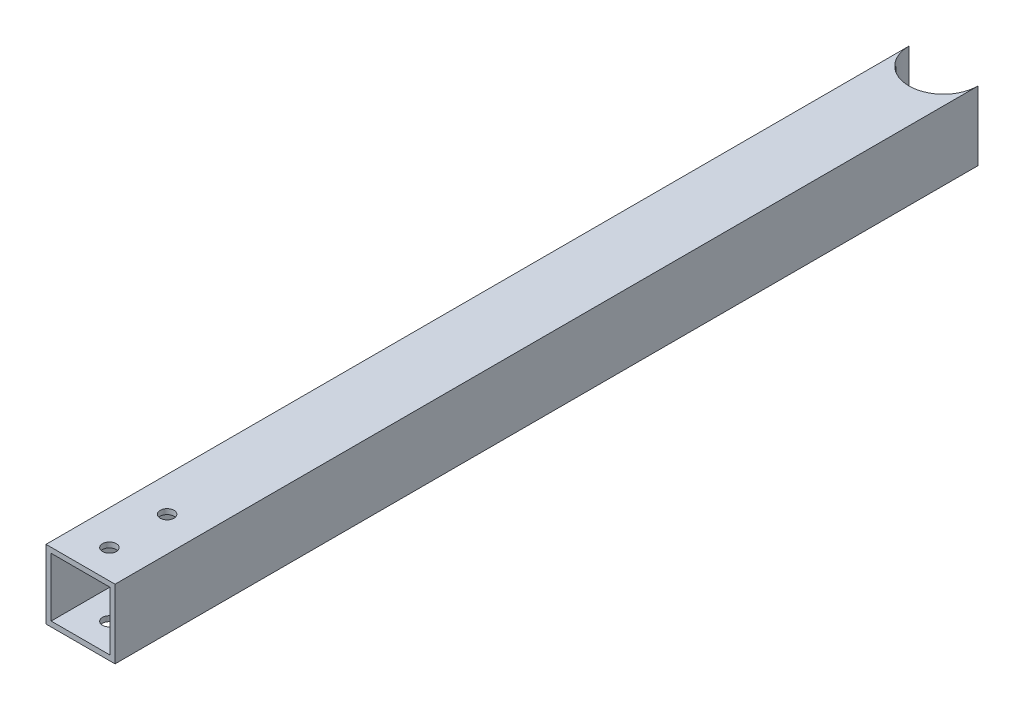
from build123d import *

# Parameters (mm, degrees)
SKETCH1_W           = 40
SKETCH1_H           = 40
SKETCH1_W_2         = 34
SKETCH1_H_2         = 34
BOSS_EXTRUDE1_DEPTH = 500
SKETCH2_R           = 4
SKETCH2_R_2         = 20
CUT_EXTRUDE1_DEPTH  = 600


with BuildPart() as part:
    # Sketch1 → Boss-Extrude1 (new body)
    with BuildSketch(Plane.XY):
        with Locations((20, 20)):
            Rectangle(SKETCH1_W, SKETCH1_H)
        with Locations((20, 20)):
            Rectangle(SKETCH1_W_2, SKETCH1_H_2, mode=Mode.SUBTRACT)
    extrude(amount=BOSS_EXTRUDE1_DEPTH)

    # Sketch2 → Cut-Extrude1 (cut)
    with BuildSketch(Plane(origin=(0, 40, 0), x_dir=(1, 0, 0), z_dir=(0, 1, 0))):
        with Locations((20, -483.273109788)):
            Circle(SKETCH2_R)
        with Locations((20, -449.819329365)):
            Circle(SKETCH2_R)
        with Locations((20, 0)):
            Circle(SKETCH2_R_2)
    extrude(amount=-CUT_EXTRUDE1_DEPTH, mode=Mode.SUBTRACT)


solid = part.part
